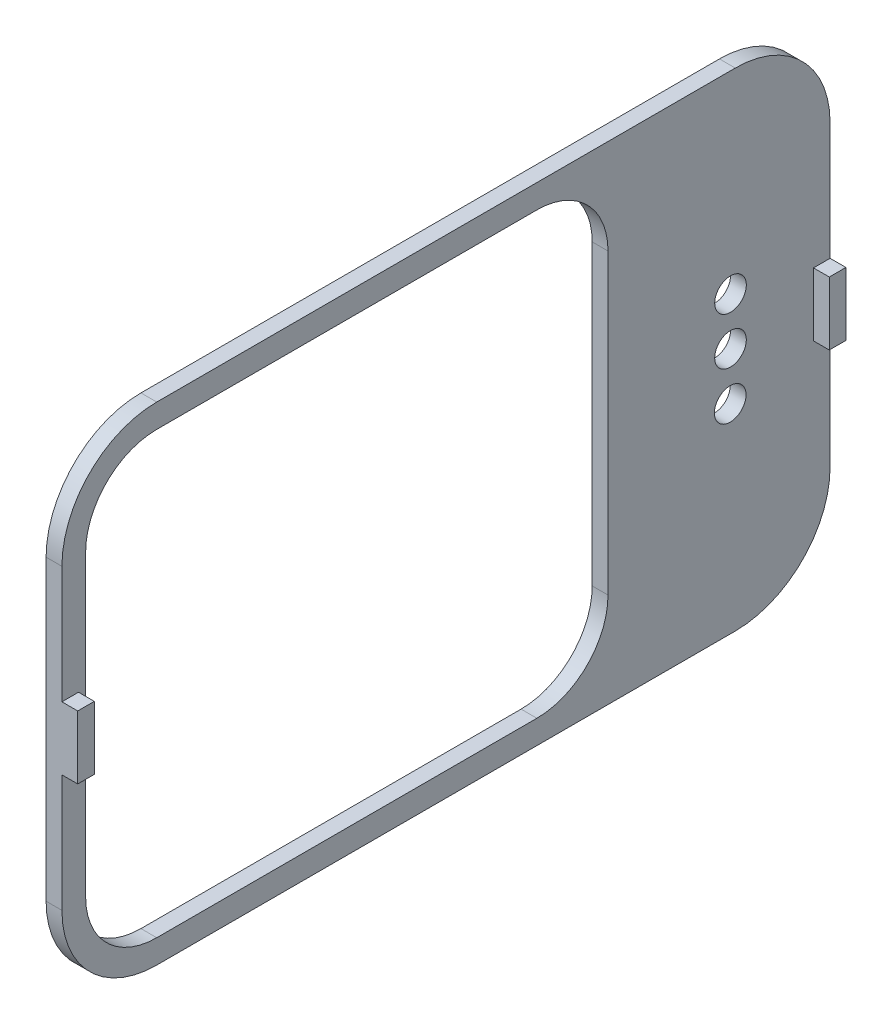
from build123d import *

# Parameters (mm, degrees)
EXTRUDE_1_DEPTH     = 1
CUT_EXTRUDE_1_DEPTH = 37.491665624
SKETCH_3_R          = 1
CUT_EXTRUDE_2_DEPTH = 37.491665624
SKETCH_4_W          = 1.05
SKETCH_4_H          = 4
EXTRUDE_2_DEPTH     = 1


with BuildPart() as part:
    # 草图1 → 凸台-拉伸1 (new body)
    with BuildSketch(Plane(origin=(0, 0, 0), x_dir=(0, 0, -1), z_dir=(1, 0, 0))):
        with BuildLine():
            Line((26.81023643, -0.114339859), (26.81023643, 18.735660141))
            ThreePointArc((26.81023643, 18.735660141), (25.052877117, 22.978300828), (20.81023643, 24.735660141))
            Line((20.81023643, 24.735660141), (-15.78976357, 24.735660141))
            ThreePointArc((-15.78976357, 24.735660141), (-20.032404257, 22.978300828), (-21.78976357, 18.735660141))
            Line((-21.78976357, 18.735660141), (-21.78976357, -0.114339859))
            ThreePointArc((-21.78976357, -0.114339859), (-20.032404257, -4.356980547), (-15.78976357, -6.114339859))
            Line((-15.78976357, -6.114339859), (20.81023643, -6.114339859))
            ThreePointArc((20.81023643, -6.114339859), (25.052877117, -4.356980547), (26.81023643, -0.114339859))
        make_face()
    extrude(amount=EXTRUDE_1_DEPTH)

    # 草图2 → 切除-拉伸1 (cut, through all)
    with BuildSketch(Plane.ZY):
        with BuildLine():
            Line((-12.759806157, 18.735660141), (-12.759806157, -0.114339859))
            ThreePointArc((-12.759806157, -0.114339859), (-11.441786673, -3.296320375), (-8.259806157, -4.614339859))
            Line((-8.259806157, -4.614339859), (15.78976357, -4.614339859))
            ThreePointArc((15.78976357, -4.614339859), (18.971744085, -3.296320375), (20.28976357, -0.114339859))
            Line((20.28976357, -0.114339859), (20.28976357, 18.735660141))
            ThreePointArc((20.28976357, 18.735660141), (18.971744085, 21.917640656), (15.78976357, 23.235660141))
            Line((15.78976357, 23.235660141), (-8.259806157, 23.235660141))
            ThreePointArc((-8.259806157, 23.235660141), (-11.441786673, 21.917640656), (-12.759806157, 18.735660141))
        make_face()
    extrude(amount=-CUT_EXTRUDE_1_DEPTH, mode=Mode.SUBTRACT)

    # 草图3 → 切除-拉伸2 (cut, through all)
    with BuildSketch(Plane.ZY):
        with Locations((-20.491320576, 6.494332556)):
            Circle(SKETCH_3_R)
        with Locations((-20.509806157, 9.502465399)):
            Circle(SKETCH_3_R)
        with Locations((-20.509806157, 12.502465399)):
            Circle(SKETCH_3_R)
    extrude(amount=-CUT_EXTRUDE_2_DEPTH, mode=Mode.SUBTRACT)

    # 草图4 → 凸台-拉伸2 (add)
    with BuildSketch(Plane(origin=(1, 0, 0), x_dir=(0, 0, -1), z_dir=(1, 0, 0))):
        with Locations((-21.26476357, 9.310660141)):
            Rectangle(SKETCH_4_W, SKETCH_4_H)
        with Locations((26.28523643, 9.310660141)):
            Rectangle(SKETCH_4_W, SKETCH_4_H)
    extrude(amount=EXTRUDE_2_DEPTH)


solid = part.part
